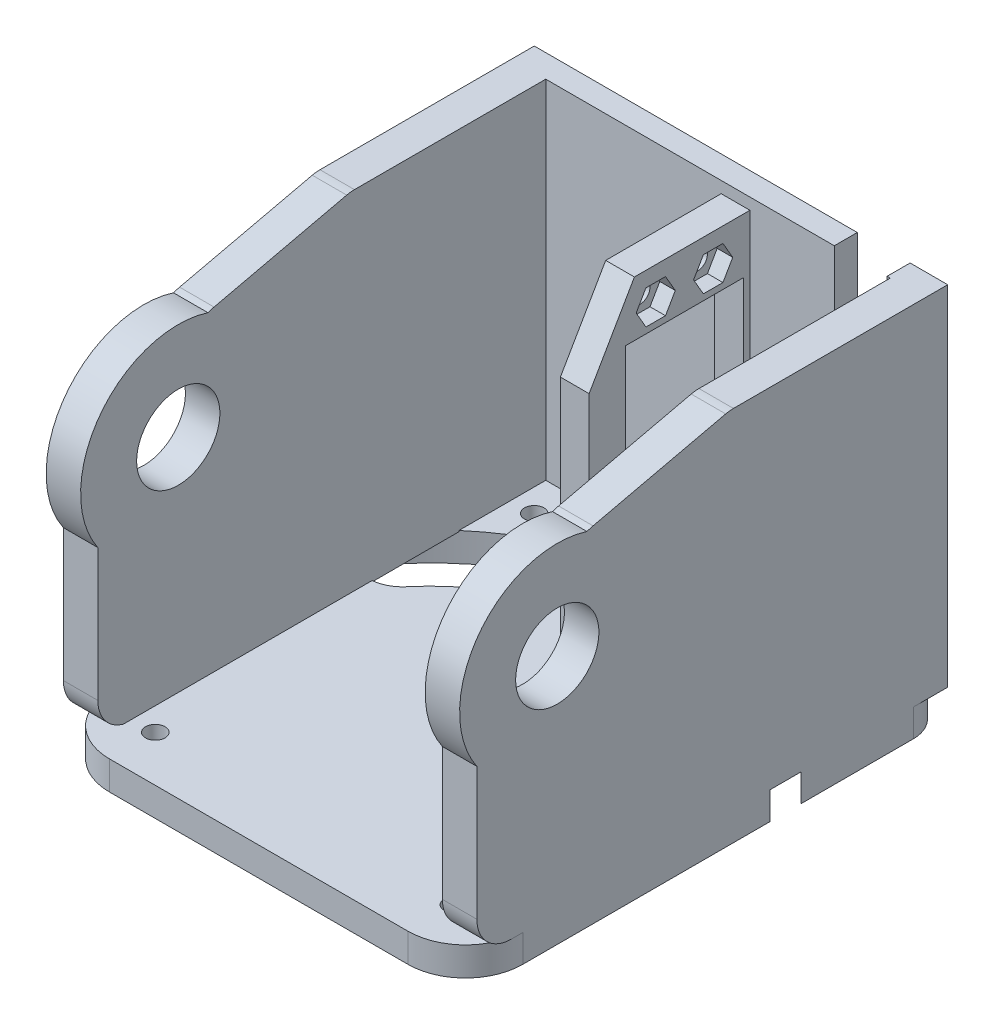
from build123d import *

# Parameters (mm, degrees)
BASE_START                    = 59
BASE_PLATE_DEPTH              = 5
BOLT_START                    = 58.8
SKETCH2_R                     = 1.7
BOLT_HOLES_CABLE_KIDNEY_DEPTH = 5.4
CHEEK_START                   = -36
CHEEK_X_DEPTH                 = 6
PIVOT_START                   = -36
SKETCH4_R                     = 17
PIVOT_BOSS_X_DEPTH            = 6
CHEEK_START_2                 = 30
CHEEK_X_2_DEPTH               = 6
PIVOT_START_2                 = 30
SKETCH6_R                     = 17
PIVOT_BOSS_X_2_DEPTH          = 6
JOURNAL_START                 = -37
SKETCH7_R                     = 7.25
JOURNAL_BORES_DEPTH           = 74
BACK_START                    = -54
SKETCH8_W                     = 72
SKETCH8_H                     = 60.7
BACK_WALL_DEPTH               = 4
PINION_START                  = -55
SKETCH9_W                     = 9.2
SKETCH9_H                     = 45
PINION_NOTCH_DEPTH            = 6
SERVO_START                   = 0.55
SKETCH10_W                    = 28.2
SKETCH10_H                    = 58.7
SKETCH10_W_2                  = 20.5
SKETCH10_H_2                  = 41.5
SERVO_BULKHEAD_DEPTH          = 5
TAB_START                     = 0.35
SKETCH11_R                    = 1.7
TAB_BOLT_HOLES_DEPTH          = 5.4
TAB_START_2                   = 2.85
TAB_NUT_POCKETS_DEPTH         = 2.9
BULKHEAD_START                = 0.35
BULKHEAD_CHAMFER_DEPTH        = 5.4


with BuildPart() as part:
    # Sketch1 → Base plate (new body)
    with BuildSketch(Plane(origin=(0, 0, 0), x_dir=(1, 0, 0), z_dir=(0, 1, 0)).offset(BASE_START)):
        with BuildLine():
            Line((-30, 54), (30, 54))
            ThreePointArc((30, 54), (34.242640687, 52.242640687), (36, 48))
            Line((36, 48), (36, -20))
            ThreePointArc((36, -20), (33.071067812, -27.071067812), (26, -30))
            Line((26, -30), (-26, -30))
            ThreePointArc((-26, -30), (-33.071067812, -27.071067812), (-36, -20))
            Line((-36, -20), (-36, 48))
            ThreePointArc((-36, 48), (-34.242640687, 52.242640687), (-30, 54))
        make_face()
    extrude(amount=BASE_PLATE_DEPTH)

    # Sketch2 → Bolt holes + cable kidney (cut)
    with BuildSketch(Plane(origin=(0, 0, 0), x_dir=(1, 0, 0), z_dir=(0, 1, 0)).offset(BOLT_START)):
        with Locations((-26, 44)):
            Circle(SKETCH2_R)
        with Locations((-26, -22)):
            Circle(SKETCH2_R)
        with Locations((26, 44)):
            Circle(SKETCH2_R)
        with Locations((26, -22)):
            Circle(SKETCH2_R)
        with BuildLine():
            ThreePointArc((-35.238044383, 29.568230046), (0, 46), (35.238044383, 29.568230046))
            ThreePointArc((35.238044383, 29.568230046), (34.498503383, 21.115237729), (26.045511066, 21.854778729))
            ThreePointArc((26.045511066, 21.854778729), (0, 34), (-26.045511066, 21.854778729))
            ThreePointArc((-26.045511066, 21.854778729), (-34.498503383, 21.115237729), (-35.238044383, 29.568230046))
        make_face()
    extrude(amount=BOLT_HOLES_CABLE_KIDNEY_DEPTH, mode=Mode.SUBTRACT)


with BuildPart() as bolt_holes_cable_kidney_piece_1:
    # of the separate pieces the step leaves, piece 1, a body of its own (bolt_holes_cable_kidney_pieces)
    add(part.part.solids().sort_by_distance((-36, 59, 20))[0])



with BuildPart() as bolt_holes_cable_kidney_piece_2:
    # of the separate pieces the step leaves, piece 2, a body of its own (bolt_holes_cable_kidney_pieces)
    add(part.part.solids().sort_by_distance((-30, 59, -54))[0])


with BuildPart() as bolt_holes_cable_kidney_piece_1_1:
    add(bolt_holes_cable_kidney_piece_1.part)

    add(bolt_holes_cable_kidney_piece_2.part)  # Cheek -X merges Bolt holes + cable kidney piece 2
    # Sketch3 → Cheek -X (add)
    with BuildSketch(Plane(origin=(0, 0, 0), x_dir=(0, 0, -1), z_dir=(1, 0, 0)).offset(CHEEK_START)):
        with BuildLine():
            Line((54, 63.8), (-22, 63.8))
            ThreePointArc((-22, 63.8), (-26.242640687, 65.557359313), (-28, 69.8))
            Line((-28, 69.8), (-28, 96.357864376))
            ThreePointArc((-28, 96.357864376), (-27.238795325, 100.1846987), (-25.071067812, 103.428932188))
            Line((-25.071067812, 103.428932188), (-11.622364452, 116.877635548))
            ThreePointArc((-11.622364452, 116.877635548), (-9.843658462, 118.217921148), (-7.764386256, 119.015910864))
            Line((-7.764386256, 119.015910864), (15.334171088, 124.346347174))
            ThreePointArc((15.334171088, 124.346347174), (16.004388899, 124.461463035), (16.683328128, 124.5))
            Line((16.683328128, 124.5), (54, 124.5))
            Line((54, 124.5), (54, 63.8))
        make_face()
    extrude(amount=CHEEK_X_DEPTH)

    # Sketch4 → Pivot boss -X (add)
    with BuildSketch(Plane(origin=(0, 0, 0), x_dir=(0, 0, -1), z_dir=(1, 0, 0)).offset(PIVOT_START)):
        with Locations((-14, 102.5)):
            Circle(SKETCH4_R)
    extrude(amount=PIVOT_BOSS_X_DEPTH)

    # Sketch5 → Cheek _X 2 (add)
    with BuildSketch(Plane(origin=(0, 0, 0), x_dir=(0, 0, -1), z_dir=(1, 0, 0)).offset(CHEEK_START_2)):
        with BuildLine():
            Line((54, 63.8), (-22, 63.8))
            ThreePointArc((-22, 63.8), (-26.242640687, 65.557359313), (-28, 69.8))
            Line((-28, 69.8), (-28, 96.357864376))
            ThreePointArc((-28, 96.357864376), (-27.238795325, 100.1846987), (-25.071067812, 103.428932188))
            Line((-25.071067812, 103.428932188), (-11.622364452, 116.877635548))
            ThreePointArc((-11.622364452, 116.877635548), (-9.843658462, 118.217921148), (-7.764386256, 119.015910864))
            Line((-7.764386256, 119.015910864), (15.334171088, 124.346347174))
            ThreePointArc((15.334171088, 124.346347174), (16.004388899, 124.461463035), (16.683328128, 124.5))
            Line((16.683328128, 124.5), (54, 124.5))
            Line((54, 124.5), (54, 63.8))
        make_face()
    extrude(amount=CHEEK_X_2_DEPTH)

    # Sketch6 → Pivot boss _X 2 (add)
    with BuildSketch(Plane(origin=(0, 0, 0), x_dir=(0, 0, -1), z_dir=(1, 0, 0)).offset(PIVOT_START_2)):
        with Locations((-14, 102.5)):
            Circle(SKETCH6_R)
    extrude(amount=PIVOT_BOSS_X_2_DEPTH)

    # Sketch7 → Journal bores (cut)
    with BuildSketch(Plane(origin=(0, 0, 0), x_dir=(0, 0, -1), z_dir=(1, 0, 0)).offset(JOURNAL_START)):
        with Locations((-14, 102.5)):
            Circle(SKETCH7_R)
    extrude(amount=JOURNAL_BORES_DEPTH, mode=Mode.SUBTRACT)

    # Sketch8 → Back wall (add)
    with BuildSketch(Plane.XY.offset(BACK_START)):
        with Locations((0, 94.15)):
            Rectangle(SKETCH8_W, SKETCH8_H)
    extrude(amount=BACK_WALL_DEPTH)

    # Sketch9 → Pinion notch (cut)
    with BuildSketch(Plane.XY.offset(PINION_START)):
        with Locations((24.85, 103)):
            Rectangle(SKETCH9_W, SKETCH9_H)
    extrude(amount=PINION_NOTCH_DEPTH, mode=Mode.SUBTRACT)

    # Sketch10 → Servo bulkhead (add)
    with BuildSketch(Plane(origin=(0, 0, 0), x_dir=(0, 0, -1), z_dir=(1, 0, 0)).offset(SERVO_START)):
        with Locations((36.1, 93.15)):
            Rectangle(SKETCH10_W, SKETCH10_H)
        with Locations((38.6, 92.15)):
            Rectangle(SKETCH10_W_2, SKETCH10_H_2, mode=Mode.SUBTRACT)
    extrude(amount=SERVO_BULKHEAD_DEPTH)

    # Sketch11 → Tab bolt holes (cut)
    with BuildSketch(Plane(origin=(0, 0, 0), x_dir=(0, 0, -1), z_dir=(1, 0, 0)).offset(TAB_START)):
        with Locations((33.6, 116.9)):
            Circle(SKETCH11_R)
        with Locations((43.6, 116.9)):
            Circle(SKETCH11_R)
        with Locations((33.6, 67.4)):
            Circle(SKETCH11_R)
        with Locations((43.6, 67.4)):
            Circle(SKETCH11_R)
    extrude(amount=TAB_BOLT_HOLES_DEPTH, mode=Mode.SUBTRACT)

    # Sketch12 → Tab nut pockets (cut)
    with BuildSketch(Plane(origin=(0, 0, 0), x_dir=(0, 0, -1), z_dir=(1, 0, 0)).offset(TAB_START_2)):
        Polygon((31.896816706, 119.85), (30.193633412, 116.9), (31.896816706, 113.95), (35.303183294, 113.95), (37.006366588, 116.9), (35.303183294, 119.85), align=None)
        Polygon((41.896816706, 119.85), (40.193633412, 116.9), (41.896816706, 113.95), (45.303183294, 113.95), (47.006366588, 116.9), (45.303183294, 119.85), align=None)
        Polygon((31.896816706, 70.35), (30.193633412, 67.4), (31.896816706, 64.45), (35.303183294, 64.45), (37.006366588, 67.4), (35.303183294, 70.35), align=None)
        Polygon((41.896816706, 70.35), (40.193633412, 67.4), (41.896816706, 64.45), (45.303183294, 64.45), (47.006366588, 67.4), (45.303183294, 70.35), align=None)
    extrude(amount=TAB_NUT_POCKETS_DEPTH, mode=Mode.SUBTRACT)

    # Sketch13 → Bulkhead chamfer (cut)
    with BuildSketch(Plane(origin=(0, 0, 0), x_dir=(0, 0, -1), z_dir=(1, 0, 0)).offset(BULKHEAD_START)):
        Polygon((21.8, 108.5), (21.8, 122.7), (30, 122.7), align=None)
    extrude(amount=BULKHEAD_CHAMFER_DEPTH, mode=Mode.SUBTRACT)


solid = bolt_holes_cable_kidney_piece_1_1.part
